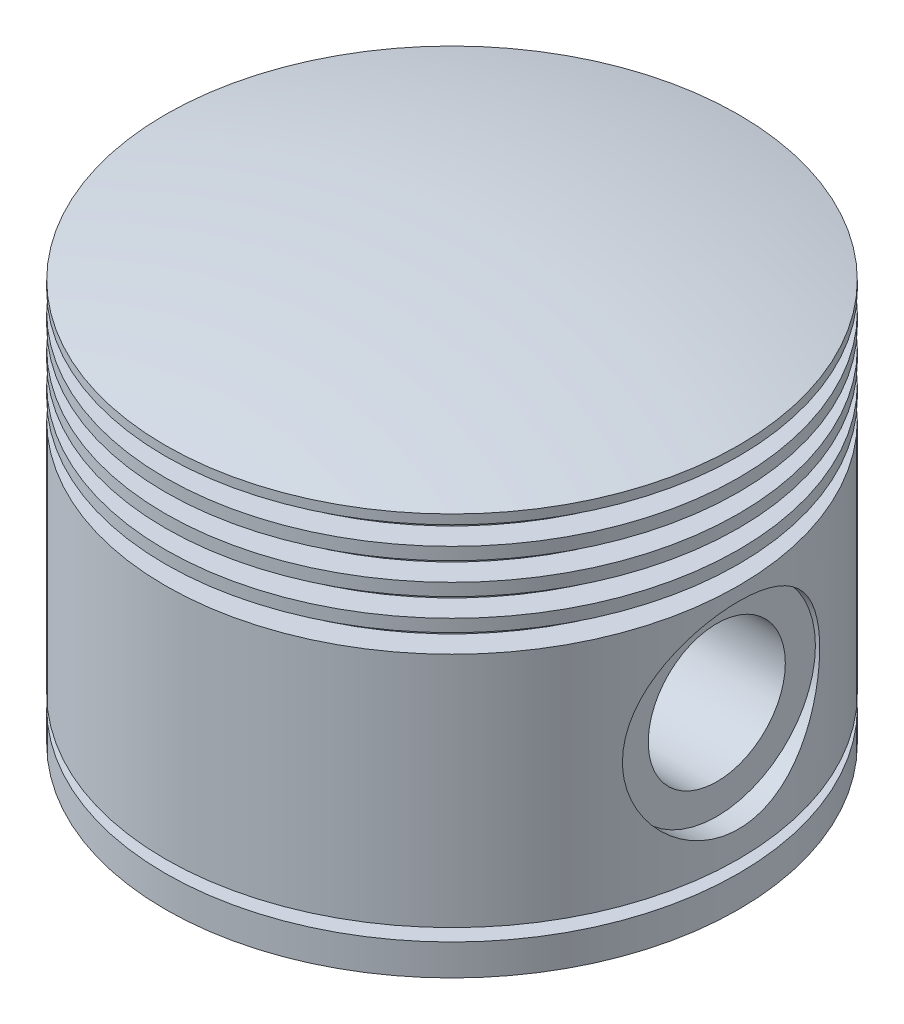
from build123d import *

# Parameters (mm, degrees)
CUT_EXTRUDE1_DEPTH       = 96.693429754
CUT_EXTRUDE1_DEPTH_BACK  = 96.693429754
SKETCH2_R                = 11
CUT_EXTRUDE2_START       = 42.5
SKETCH3_R                = 15.831165008
CUT_EXTRUDE2_DEPTH       = 54.193429754
BOSS_EXTRUDE1_REACH      = 122.693
BOSS_EXTRUDE1_END_RADIUS = 37
BOSS_EXTRUDE1_START      = -25
SKETCH4_R                = 18
SKETCH4_R_2              = 11
BOSS_EXTRUDE4_DEPTH      = 12
BOSS_EXTRUDE4_DEPTH_BACK = 0.5
BOSS_EXTRUDE4_START      = 25
SKETCH5_R                = 18
SKETCH5_R_2              = 11


with BuildPart() as part:
    # Sketch1 → Revolve1 (revolve)
    with BuildSketch(Plane.XY):
        with BuildLine():
            ThreePointArc((0, 70.18), (-23.17477604, 68.75543976), (-46, 64.5))
            Line((-46, 64.5), (-46, 63))
            Line((-46, 63), (-42, 63))
            Line((-42, 63), (-42, 60))
            Line((-42, 60), (-46, 60))
            Line((-46, 60), (-46, 58))
            Line((-46, 58), (-42, 58))
            Line((-42, 58), (-42, 55))
            Line((-42, 55), (-46, 55))
            Line((-46, 55), (-46, 53))
            Line((-46, 53), (-42, 53))
            Line((-42, 53), (-42, 50))
            Line((-42, 50), (-46, 50))
            Line((-46, 50), (-46, 48))
            Line((-46, 48), (-42, 48))
            Line((-42, 48), (-42, 45))
            Line((-42, 45), (-46, 45))
            Line((-46, 45), (-46, 7))
            Line((-46, 7), (-42.5, 7))
            Line((-42.5, 7), (-42.5, 5))
            Line((-42.5, 5), (-46, 5))
            Line((-46, 5), (-46, 0))
            Line((-46, 0), (-37, 0))
            Line((-37, 0), (-37, 62))
            Line((-37, 62), (0, 62))
            Line((0, 62), (0, 70.18))
        make_face()
    revolve(axis=Axis((0, 70.18, 0), (0, -1, 0)))

    # Sketch2 → Cut-Extrude1 (cut, two sides: drawn at the far end of the back side and taken through both)
    with BuildSketch(Plane(origin=(0, 0, 0), x_dir=(0, 0, -1), z_dir=(1, 0, 0)).offset(-CUT_EXTRUDE1_DEPTH_BACK)):
        with Locations((0, 27)):
            Circle(SKETCH2_R)
    extrude(amount=CUT_EXTRUDE1_DEPTH + CUT_EXTRUDE1_DEPTH_BACK, mode=Mode.SUBTRACT)

    # Sketch3 → Cut-Extrude2 (cut)
    with BuildSketch(Plane(origin=(0, 0, 0), x_dir=(0, 0, -1), z_dir=(1, 0, 0)).offset(CUT_EXTRUDE2_START)):
        with Locations((0, 27)):
            Circle(SKETCH3_R)
    cut_extrude2 = extrude(amount=CUT_EXTRUDE2_DEPTH, mode=Mode.SUBTRACT)

    # Mirror1: Cut-Extrude2 across plane
    add(cut_extrude2.mirror(Plane(origin=(0, 0, 0), x_dir=(0, 0, 1), z_dir=(1, 0, 0))), mode=Mode.SUBTRACT)

    # Sketch5 → Boss-Extrude4 (add, two sides: drawn at the far end of the back side and taken through both)
    with BuildSketch(Plane(origin=(0, 0, 0), x_dir=(0, 0, -1), z_dir=(1, 0, 0)).offset(BOSS_EXTRUDE4_START - BOSS_EXTRUDE4_DEPTH_BACK)):
        with Locations((0, 27)):
            Circle(SKETCH5_R)
        with Locations((0, 27)):
            Circle(SKETCH5_R_2, mode=Mode.SUBTRACT)
    extrude(amount=BOSS_EXTRUDE4_DEPTH + BOSS_EXTRUDE4_DEPTH_BACK)


with BuildPart() as body_2:
    # Boss-Extrude1: up to this cylinder (the profile starts inside it)
    boss_extrude1_end = Plane(origin=(0, 27, 0), z_dir=(0, 1, 0)) * Cylinder(BOSS_EXTRUDE1_END_RADIUS, 320.386, mode=Mode.PRIVATE)
    # Sketch4 → Boss-Extrude1 (new, up to the surface)
    with BuildSketch(Plane(origin=(0, 0, 0), x_dir=(0, 0, -1), z_dir=(1, 0, 0)).offset(BOSS_EXTRUDE1_START), mode=Mode.PRIVATE) as boss_extrude1_sk1:
        with Locations((-0.893015149, 27)):
            Circle(SKETCH4_R)
        with Locations((0, 27)):
            Circle(SKETCH4_R_2, mode=Mode.SUBTRACT)
    boss_extrude1_tool1 = extrude(boss_extrude1_sk1.sketch, amount=-BOSS_EXTRUDE1_REACH, mode=Mode.PRIVATE) & boss_extrude1_end
    add(boss_extrude1_tool1.solids().sort_by_distance((-25, 27, 18.383898))[0])


solid = Compound([part.part, body_2.part])
